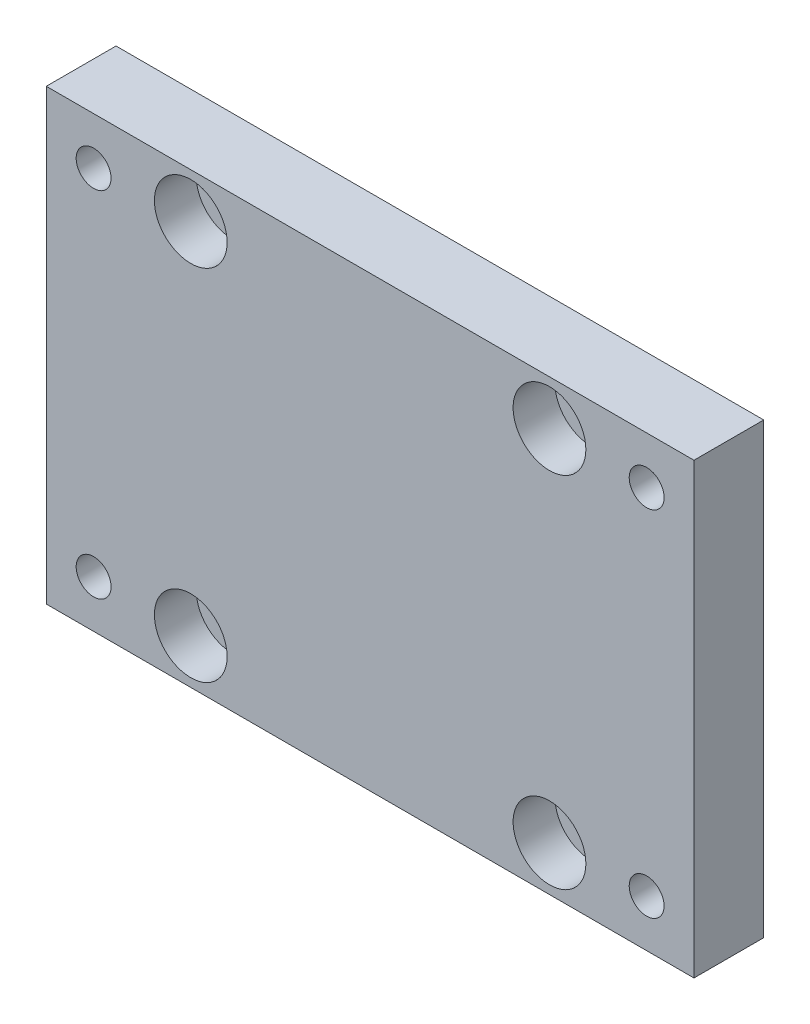
from build123d import *

# Parameters (mm, degrees)
SKETCH_2_W                = 65
SKETCH_2_H                = 45
SKETCH_2_R                = 2.25
SKETCH_2_R_2              = 1.75
EXTRUDE_1_DEPTH           = 7
HOLE_WIZARD_1_D           = 4.5
HOLE_WIZARD_1_CBORE_D     = 7.3
HOLE_WIZARD_1_CBORE_DEPTH = 4.2
SKETCH_5_R                = 2.9
CUT_EXTRUDE_2_DEPTH       = 3.1


with BuildPart() as part:
    # 草圖2 → 填料-伸長1 (new body)
    with BuildSketch(Plane.XY):
        Rectangle(SKETCH_2_W, SKETCH_2_H)
        with Locations((-18, 18)):
            Circle(SKETCH_2_R, mode=Mode.SUBTRACT)
        with Locations((-27.75, 17.75)):
            Circle(SKETCH_2_R_2, mode=Mode.SUBTRACT)
        with Locations((18, 18)):
            Circle(SKETCH_2_R, mode=Mode.SUBTRACT)
        with Locations((18, -18)):
            Circle(SKETCH_2_R, mode=Mode.SUBTRACT)
        with Locations((-18, -18)):
            Circle(SKETCH_2_R, mode=Mode.SUBTRACT)
        with Locations((27.75, 17.75)):
            Circle(SKETCH_2_R_2, mode=Mode.SUBTRACT)
        with Locations((27.75, -17.75)):
            Circle(SKETCH_2_R_2, mode=Mode.SUBTRACT)
        with Locations((-27.75, -17.75)):
            Circle(SKETCH_2_R_2, mode=Mode.SUBTRACT)
    extrude(amount=EXTRUDE_1_DEPTH)

    # 鑽孔1 (through all)
    with Locations(Plane(origin=(-18, 18, 7), x_dir=(1, 0, 0), z_dir=(0, 0, 1))):
        with Locations((0, 0), (36, 0), (36, -36), (0, -36)):
            CounterBoreHole(HOLE_WIZARD_1_D / 2, HOLE_WIZARD_1_CBORE_D / 2, HOLE_WIZARD_1_CBORE_DEPTH)

    # 草圖5 → 除料-伸長2 (cut)
    with BuildSketch(Plane(origin=(0, 0, 0), x_dir=(-1, 0, 0), z_dir=(0, 0, -1))):
        with Locations((-27.75, 17.75)):
            Circle(SKETCH_5_R)
        with Locations((27.75, 17.75)):
            Circle(SKETCH_5_R)
        with Locations((27.75, -17.75)):
            Circle(SKETCH_5_R)
        with Locations((-27.75, -17.75)):
            Circle(SKETCH_5_R)
    extrude(amount=-CUT_EXTRUDE_2_DEPTH, mode=Mode.SUBTRACT)


solid = part.part
